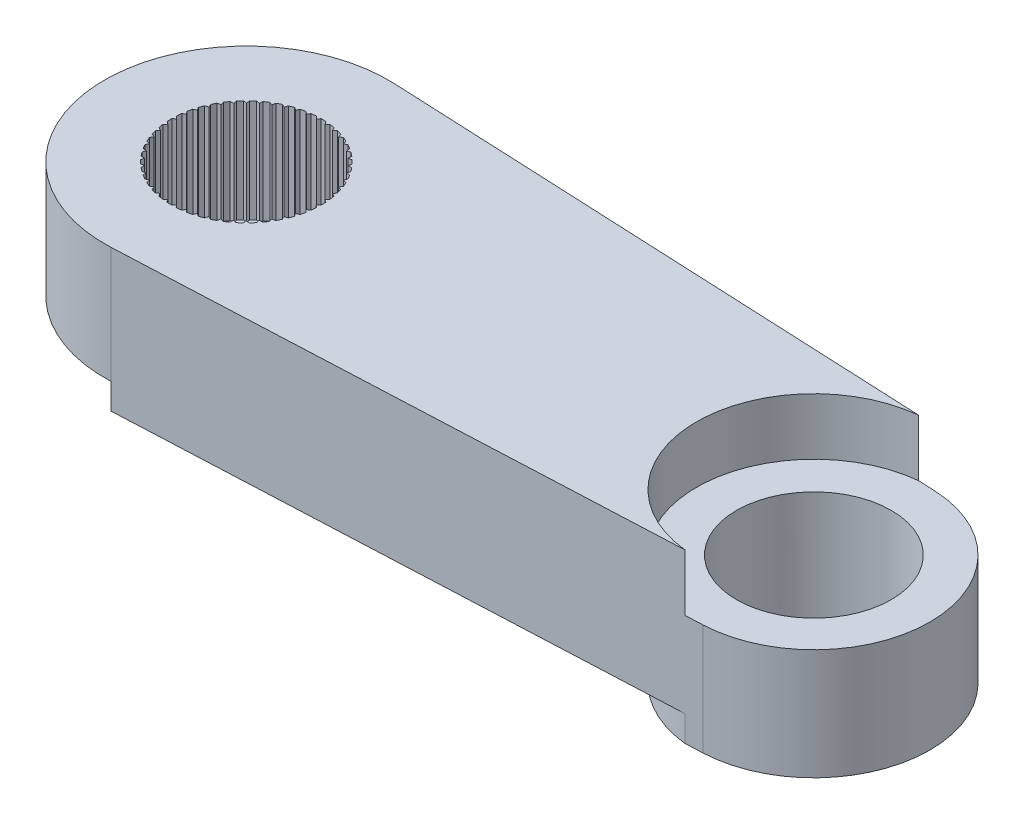
from build123d import *
from build123d.topology import SkipClean

# Parameters (mm, degrees)
SKETCH1_R               = 1.5
SKETCH1_R_2             = 3
BOSS_EXTRUDE1_DEPTH     = 3.5
SKETCH2_R               = 4.7
SKETCH2_R_2             = 2.9
BOSS_EXTRUDE2_DEPTH     = 3
CUT_EXTRUDE1_START      = -1
SKETCH3_R               = 2.9
CUT_EXTRUDE1_DEPTH      = 1
SKETCH4_R               = 3
SKETCH4_R_2             = 4.7
BOSS_EXTRUDE3_DEPTH     = 1.8
CUT_EXTRUDE2_DEPTH      = 1
BOSS_EXTRUDE4_OUTLINE_R = 4.7
BOSS_EXTRUDE4_DEPTH     = 1
CUT_EXTRUDE3_START      = -1
SKETCH7_R               = 3
CUT_EXTRUDE3_DEPTH      = 1
BOSS_EXTRUDE5_START     = -5.3
SKETCH7_2_R             = 3
BOSS_EXTRUDE5_DEPTH     = 1
BOSS_EXTRUDE6_DEPTH     = 4
CIRPATTERN1_COUNT       = 50
SKETCH9_R               = 5.5
CUT_EXTRUDE4_DEPTH      = 1
SKETCH10_R              = 4.7
BOSS_EXTRUDE7_DEPTH     = 0.2


# Read off the part's stored shape, not the designer's step: Boss-Extrude4
with BuildPart() as part:
    # Sketch1 → Boss-Extrude1 (new body)
    with BuildSketch(Plane(origin=(0, 0, 0), x_dir=(1, 0, 0), z_dir=(0, 1, 0))):
        with BuildLine():
            Line((0.25, 5.494315244), (22.204545455, 4.495348836))
            ThreePointArc((22.204545455, 4.495348836), (26.5, 0), (22.204545455, -4.495348836))
            Line((22.204545455, -4.495348836), (0.25, -5.494315244))
            ThreePointArc((0.25, -5.494315244), (-5.5, 0), (0.25, 5.494315244))
        make_face()
        with Locations(Location((0, 0, 0), (0, 0, 270))):
            Circle(SKETCH1_R, mode=Mode.SUBTRACT)
        with Locations(Location((22, 0, 0), (0, 0, 270))):
            Circle(SKETCH1_R_2, mode=Mode.SUBTRACT)
    extrude(amount=BOSS_EXTRUDE1_DEPTH)

    # Sketch2 → Boss-Extrude2 (add)
    with BuildSketch(Plane(origin=(0, 3.5, 0), x_dir=(1, 0, 0), z_dir=(0, 1, 0))):
        with Locations(Location((0, 0, 0), (0, 0, 90))):
            Circle(SKETCH2_R)
        with Locations(Location((0, 0, 0), (0, 0, 270))):
            Circle(SKETCH2_R_2, mode=Mode.SUBTRACT)
    extrude(amount=BOSS_EXTRUDE2_DEPTH)

    # Sketch3 → Cut-Extrude1 (cut)
    with BuildSketch(Plane(origin=(0, 3.5, 0), x_dir=(1, 0, 0), z_dir=(0, 1, 0)).offset(CUT_EXTRUDE1_START)):
        with Locations(Location((0, 0, 0), (0, 0, 270))):
            Circle(SKETCH3_R)
    extrude(amount=CUT_EXTRUDE1_DEPTH, mode=Mode.SUBTRACT)

    # Sketch4 → Boss-Extrude3 (add)
    with SkipClean():  # the faces are left unmerged after this step: merging them gives an invalid solid
        with BuildSketch(Plane(origin=(0, 3.5, 0), x_dir=(1, 0, 0), z_dir=(0, 1, 0))):
            with BuildLine():
                Line((0.25, -5.494315244), (22.204545455, -4.495348836))
                ThreePointArc((22.204545455, -4.495348836), (26.5, 0), (22.204545455, 4.495348836))
                Line((22.204545455, 4.495348836), (0.25, 5.494315244))
                ThreePointArc((0.25, 5.494315244), (-5.5, 0), (0.25, -5.494315244))
            make_face()
            with Locations(Location((22, 0, 0), (0, 0, 270))):
                Circle(SKETCH4_R, mode=Mode.SUBTRACT)
            with Locations(Location((0, 0, 0), (0, 0, 270))):
                Circle(SKETCH4_R_2, mode=Mode.SUBTRACT)
        extrude(amount=BOSS_EXTRUDE3_DEPTH)

    # Sketch5 → Cut-Extrude2 (cut)
    with SkipClean():  # the faces are left unmerged after this step: merging them gives an invalid solid
        with BuildSketch(Plane.XZ):
            with BuildLine():
                Line((22.204545455, 4.495348836), (0.25, 5.494315244))
                ThreePointArc((0.25, 5.494315244), (-5.5, 0), (0.25, -5.494315244))
                Line((0.25, -5.494315244), (22.204545455, -4.495348836))
                ThreePointArc((22.204545455, -4.495348836), (26.5, 0), (22.204545455, 4.495348836))
            make_face()
        extrude(amount=-CUT_EXTRUDE2_DEPTH, mode=Mode.SUBTRACT)

    # Boss-Extrude4 outline → Boss-Extrude4 (add)
    with SkipClean():  # the faces are left unmerged after this step: merging them gives an invalid solid
        with BuildSketch(Plane(origin=(0, 5.3, 0), x_dir=(1, 0, 0), z_dir=(0, 1, 0))):
            with BuildLine():
                ThreePointArc((21.53255953, -4.525925254), (17.45, 0), (21.53255953, 4.525925254))
                Line((21.53255953, 4.525925254), (0.25, 5.494315244))
                ThreePointArc((0.25, 5.494315244), (-5.5, 0), (0.25, -5.494315244))
                Line((0.25, -5.494315244), (21.53255953, -4.525925254))
            make_face()
            Circle(BOSS_EXTRUDE4_OUTLINE_R, mode=Mode.SUBTRACT)
        extrude(amount=BOSS_EXTRUDE4_DEPTH)

    # Sketch7 → Cut-Extrude3 (cut)
    with SkipClean():  # the faces are left unmerged after this step: merging them gives an invalid solid
        with BuildSketch(Plane(origin=(0, 5.3, 0), x_dir=(1, 0, 0), z_dir=(0, 1, 0)).offset(CUT_EXTRUDE3_START)):
            with BuildLine():
                Line((22.204545455, 4.495348836), (21.53255953, 4.525925254))
                ThreePointArc((21.53255953, 4.525925254), (17.45, 0), (21.53255953, -4.525925254))
                Line((21.53255953, -4.525925254), (22.204545455, -4.495348836))
                ThreePointArc((22.204545455, -4.495348836), (26.5, 0), (22.204545455, 4.495348836))
            make_face()
            with Locations(Location((22, 0, 0), (0, 0, 90))):
                Circle(SKETCH7_R, mode=Mode.SUBTRACT)
        extrude(amount=CUT_EXTRUDE3_DEPTH, mode=Mode.SUBTRACT)

    # Sketch7<2> → Boss-Extrude5 (add)
    with SkipClean():  # the faces are left unmerged after this step: merging them gives an invalid solid
        with BuildSketch(Plane(origin=(0, 5.3, 0), x_dir=(1, 0, 0), z_dir=(0, 1, 0)).offset(BOSS_EXTRUDE5_START)):
            with BuildLine():
                Line((22.204545455, 4.495348836), (21.53255953, 4.525925254))
                ThreePointArc((21.53255953, 4.525925254), (17.45, 0), (21.53255953, -4.525925254))
                Line((21.53255953, -4.525925254), (22.204545455, -4.495348836))
                ThreePointArc((22.204545455, -4.495348836), (26.5, 0), (22.204545455, 4.495348836))
            make_face()
            with Locations(Location((22, 0, 0), (0, 0, 90))):
                Circle(SKETCH7_2_R, mode=Mode.SUBTRACT)
        extrude(amount=BOSS_EXTRUDE5_DEPTH)

    # Sketch8 → Boss-Extrude6 (add)
    with SkipClean():  # the faces are left unmerged after this step: merging them gives an invalid solid
        with BuildSketch(Plane(origin=(0, 2.5, 0), x_dir=(1, 0, 0), z_dir=(0, 1, 0))):
            with BuildLine():
                Line((2.894358376, -0.180802623), (2.794358376, -0.091314915))
                Line((2.794358376, -0.091314915), (2.899987405, -0.008546816))
                ThreePointArc((2.899987405, -0.008546816), (2.898452825, -0.094716546), (2.894358376, -0.180802623))
            make_face()
        boss_extrude6 = extrude(amount=BOSS_EXTRUDE6_DEPTH)

    # CirPattern1: Boss-Extrude6 ×50 about axis
    with SkipClean():  # the faces are left unmerged after this step: merging them gives an invalid solid
        cirpattern1_axis = Axis((0, 0, 0), (0, 1, 0))
        for i in range(1, CIRPATTERN1_COUNT):
            add(boss_extrude6.rotate(cirpattern1_axis, i * 360 / CIRPATTERN1_COUNT))

    # Sketch9 → Cut-Extrude4 (cut)
    with SkipClean():  # the faces are left unmerged after this step: merging them gives an invalid solid
        with BuildSketch(Plane.XZ.offset(-1)):
            Circle(SKETCH9_R)
        extrude(amount=-CUT_EXTRUDE4_DEPTH, mode=Mode.SUBTRACT)

    # Sketch10 → Boss-Extrude7 (add)
    with SkipClean():  # the faces are left unmerged after this step: merging them gives an invalid solid
        with BuildSketch(Plane(origin=(0, 6.3, 0), x_dir=(1, 0, 0), z_dir=(0, 1, 0))):
            with BuildLine():
                Line((0.25, -5.494315244), (21.53255953, -4.525925254))
                ThreePointArc((21.53255953, -4.525925254), (17.45, 0), (21.53255953, 4.525925254))
                Line((21.53255953, 4.525925254), (0.25, 5.494315244))
                ThreePointArc((0.25, 5.494315244), (-5.5, 0), (0.25, -5.494315244))
            make_face()
            Circle(SKETCH10_R, mode=Mode.SUBTRACT)
        extrude(amount=BOSS_EXTRUDE7_DEPTH)


solid = part.part
